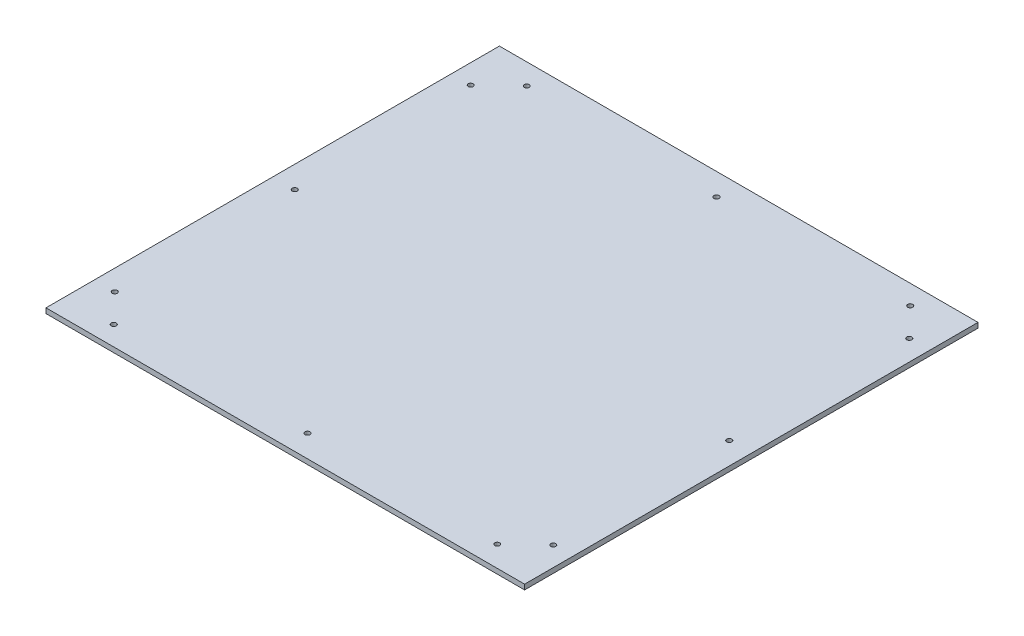
from build123d import *

# Parameters (mm, degrees)
SKETCH1_W           = 482.6
SKETCH1_H           = 457.2
BOSS_EXTRUDE1_DEPTH = 5.08
SKETCH2_R           = 2.4765
SKETCH2_R_2         = 2.54
CUT_EXTRUDE1_DEPTH  = 333.429626237


with BuildPart() as part:
    # Sketch1 → Boss-Extrude1 (new body)
    with BuildSketch(Plane(origin=(0, 0, 0), x_dir=(1, 0, 0), z_dir=(0, 1, 0))):
        Rectangle(SKETCH1_W, SKETCH1_H)
    extrude(amount=BOSS_EXTRUDE1_DEPTH)

    # Sketch2 → Cut-Extrude1 (cut, through all)
    with BuildSketch(Plane(origin=(0, 5.08, 0), x_dir=(1, 0, 0), z_dir=(0, 1, 0))):
        with Locations((-192.659, 207.53832)):
            Circle(SKETCH2_R)
        with Locations((192.659, -207.53832)):
            Circle(SKETCH2_R)
        with Locations((-221.615, 179.959)):
            Circle(SKETCH2_R)
        with Locations((221.615, -179.959)):
            Circle(SKETCH2_R)
        with Locations((220.6244, 179.959)):
            Circle(SKETCH2_R_2)
        with Locations((192.659, 208.915)):
            Circle(SKETCH2_R_2)
        with Locations((-192.659, -208.915)):
            Circle(SKETCH2_R_2)
        with Locations((-220.6244, -179.959)):
            Circle(SKETCH2_R_2)
        with Locations((-219.075, 0)):
            Circle(SKETCH2_R_2)
        with Locations((219.075, 0)):
            Circle(SKETCH2_R_2)
        with Locations((0, -206.248)):
            Circle(SKETCH2_R_2)
        with Locations((0, 206.248)):
            Circle(SKETCH2_R_2)
    extrude(amount=-CUT_EXTRUDE1_DEPTH, mode=Mode.SUBTRACT)


solid = part.part
